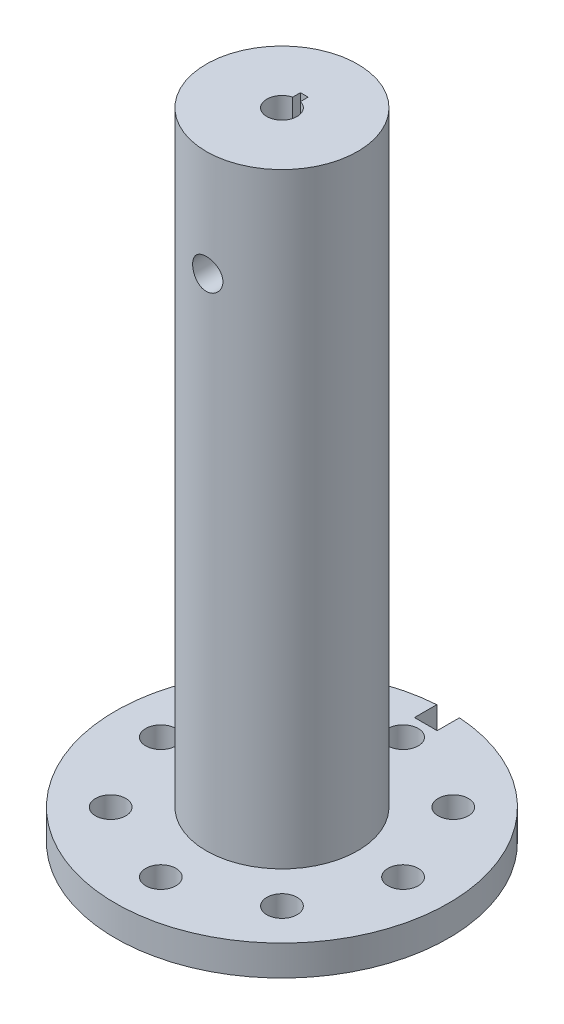
from build123d import *

# Parameters (mm, degrees)
SKETCH1_R               = 11
SKETCH1_R_2             = 1
BOSS_EXTRUDE1_DEPTH     = 2
SKETCH2_R               = 3.5
CUT_EXTRUDE1_DEPTH      = 16.684387141
SKETCH4_W               = 1.5
SKETCH4_H               = 3
CUT_EXTRUDE3_DEPTH      = 4
BOSS_EXTRUDE2_START     = 20
SKETCH5_R               = 5
SKETCH5_R_2             = 3.5
BOSS_EXTRUDE2_DEPTH     = 20
BOSS_EXTRUDE3_START     = 20
SKETCH6_R               = 5
BOSS_EXTRUDE3_DEPTH     = 20
CUT_EXTRUDE4_DEPTH      = 5
CUT_EXTRUDE4_DEPTH_BACK = 1
SKETCH7_R               = 1


with BuildPart() as part:
    # Sketch1 → Boss-Extrude1 (new body)
    with BuildSketch(Plane(origin=(0, 0, 0), x_dir=(1, 0, 0), z_dir=(0, 1, 0))):
        Circle(SKETCH1_R)
        with Locations((0, 8)):
            Circle(SKETCH1_R_2, mode=Mode.SUBTRACT)
        with Locations((5.656854249, 5.656854249)):
            Circle(SKETCH1_R_2, mode=Mode.SUBTRACT)
        with Locations((8, 0)):
            Circle(SKETCH1_R_2, mode=Mode.SUBTRACT)
        with Locations((5.656854249, -5.656854249)):
            Circle(SKETCH1_R_2, mode=Mode.SUBTRACT)
        with Locations((0, -8)):
            Circle(SKETCH1_R_2, mode=Mode.SUBTRACT)
        with Locations((-5.656854249, -5.656854249)):
            Circle(SKETCH1_R_2, mode=Mode.SUBTRACT)
        with Locations((-8, 0)):
            Circle(SKETCH1_R_2, mode=Mode.SUBTRACT)
        with Locations((-5.656854249, 5.656854249)):
            Circle(SKETCH1_R_2, mode=Mode.SUBTRACT)
    extrude(amount=BOSS_EXTRUDE1_DEPTH)

    # Sketch2 → Cut-Extrude1 (cut, through all)
    with BuildSketch(Plane(origin=(0, 2, 0), x_dir=(1, 0, 0), z_dir=(0, 1, 0))):
        Circle(SKETCH2_R)
    extrude(amount=-CUT_EXTRUDE1_DEPTH, mode=Mode.SUBTRACT)

    # Sketch4 → Cut-Extrude3 (cut)
    with BuildSketch(Plane(origin=(0, 2, 0), x_dir=(1, 0, 0), z_dir=(0, 1, 0))):
        with Locations((0, 11)):
            Rectangle(SKETCH4_W, SKETCH4_H)
    extrude(amount=-CUT_EXTRUDE3_DEPTH, mode=Mode.SUBTRACT)

    # Sketch5 → Boss-Extrude2 (add)
    with BuildSketch(Plane(origin=(0, 2, 0), x_dir=(1, 0, 0), z_dir=(0, 1, 0)).offset(BOSS_EXTRUDE2_START)):
        Circle(SKETCH5_R)
        Circle(SKETCH5_R_2, mode=Mode.SUBTRACT)
    extrude(amount=-BOSS_EXTRUDE2_DEPTH)

    # Sketch6 → Boss-Extrude3 (add)
    with BuildSketch(Plane(origin=(0, 22, 0), x_dir=(1, 0, 0), z_dir=(0, 1, 0)).offset(BOSS_EXTRUDE3_START)):
        Circle(SKETCH6_R)
        with BuildLine():
            Line((-0.255, 0.966941053), (-0.255, 1.476941053))
            Line((-0.255, 1.476941053), (0.255, 1.476941053))
            Line((0.255, 1.476941053), (0.255, 0.966941053))
            ThreePointArc((0.255, 0.966941053), (0, -1), (-0.255, 0.966941053))
        make_face(mode=Mode.SUBTRACT)
    extrude(amount=-BOSS_EXTRUDE3_DEPTH)

    # Sketch7 → Cut-Extrude4 (cut, two sides: drawn at the far end of the back side and taken through both)
    with BuildSketch(Plane.XY.offset(-CUT_EXTRUDE4_DEPTH_BACK)):
        with Locations((0, 35)):
            Circle(SKETCH7_R)
    extrude(amount=CUT_EXTRUDE4_DEPTH + CUT_EXTRUDE4_DEPTH_BACK, mode=Mode.SUBTRACT)


solid = part.part
